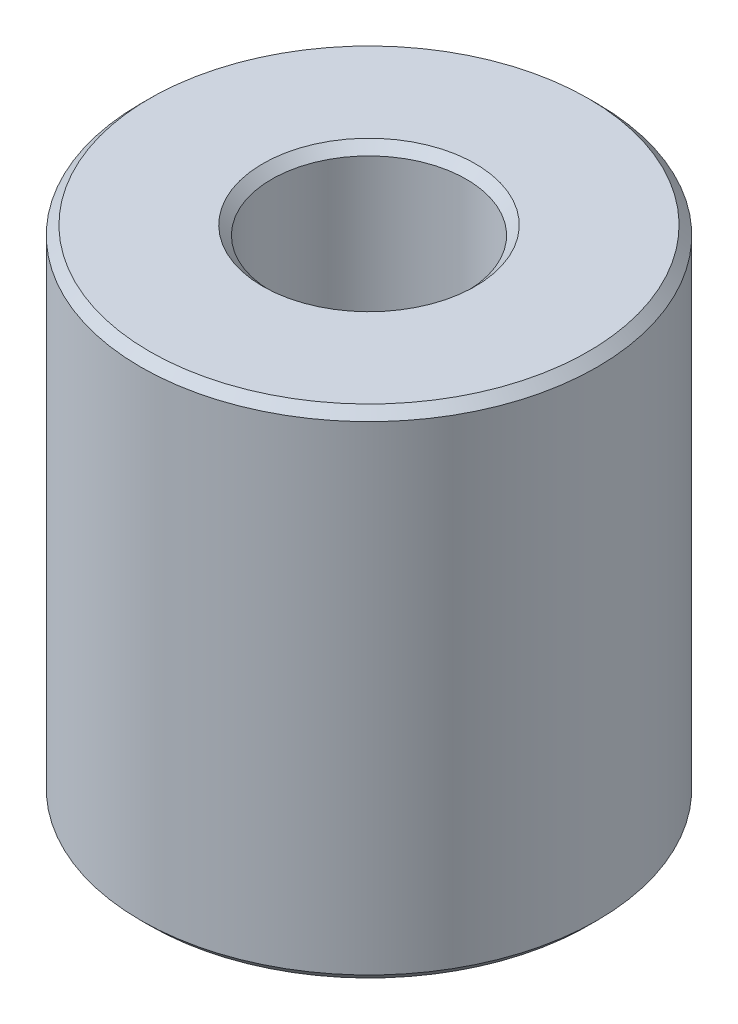
from build123d import *

# Parameters (mm, degrees)
SKETCH1_R           = 27.5
BOSS_EXTRUDE1_DEPTH = 59.898158238
SKETCH2_R           = 11.726707337
CUT_EXTRUDE1_DEPTH  = 72.416310184
CHAMFER1_SIZE       = 1.079128132


with BuildPart() as part:
    # Sketch1 → Boss-Extrude1 (new body)
    with BuildSketch(Plane(origin=(0, 0, 0), x_dir=(1, 0, 0), z_dir=(0, 1, 0))):
        Circle(SKETCH1_R)
    extrude(amount=BOSS_EXTRUDE1_DEPTH)

    # Sketch2 → Cut-Extrude1 (cut, through all)
    with BuildSketch(Plane(origin=(0, 0, 0), x_dir=(1, 0, 0), z_dir=(0, 1, 0))):
        Circle(SKETCH2_R)
    extrude(amount=CUT_EXTRUDE1_DEPTH, mode=Mode.SUBTRACT)

    # Chamfer1
    chamfer1_edges = [part.edges().sort_by_distance(p)[0] for p in [
        (-11.726707337, 59.898158238, 0),
        (-11.726707337, 0, 0),
        (-27.5, 0, 0),
        (-27.5, 59.898158238, 0),
    ]]
    chamfer(chamfer1_edges, length=CHAMFER1_SIZE)


solid = part.part
